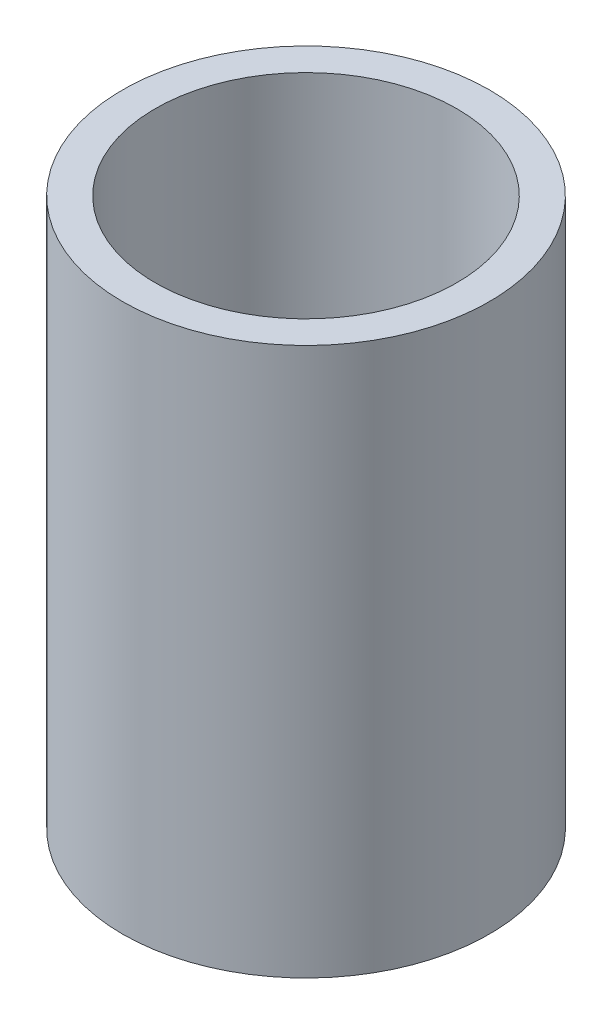
from build123d import *

# Parameters (mm, degrees)
SKETCH1_R           = 37.5
BOSS_EXTRUDE1_DEPTH = 112.004562064
SKETCH2_R           = 30.841181644
CUT_EXTRUDE1_DEPTH  = 124.925469227


with BuildPart() as part:
    # Sketch1 → Boss-Extrude1 (new body)
    with BuildSketch(Plane(origin=(0, 0, 0), x_dir=(1, 0, 0), z_dir=(0, 1, 0))):
        Circle(SKETCH1_R)
    extrude(amount=BOSS_EXTRUDE1_DEPTH)

    # Sketch2 → Cut-Extrude1 (cut, through all)
    with BuildSketch(Plane(origin=(0, 0, 0), x_dir=(1, 0, 0), z_dir=(0, 1, 0))):
        Circle(SKETCH2_R)
    extrude(amount=CUT_EXTRUDE1_DEPTH, mode=Mode.SUBTRACT)


solid = part.part
